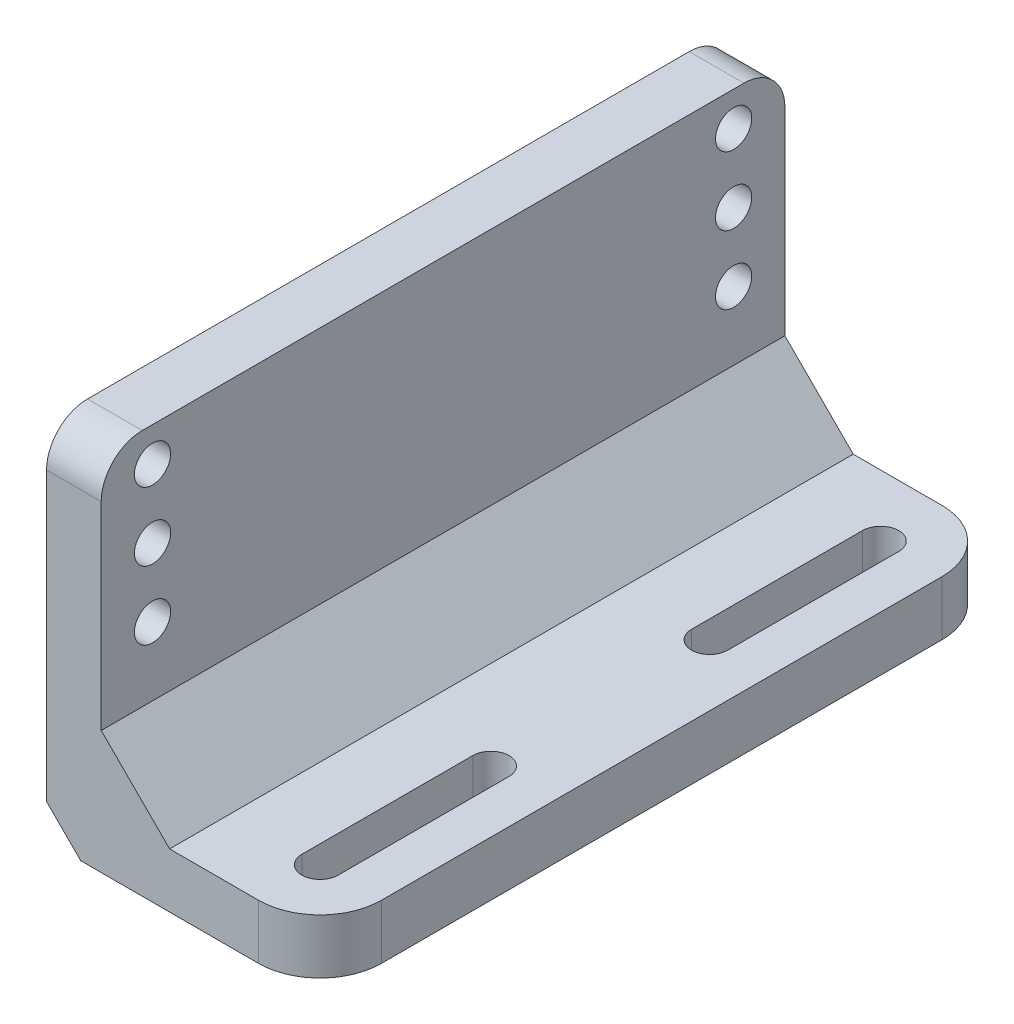
from build123d import *

# Parameters (mm, degrees)
SKETCH1_W           = 40
SKETCH1_H           = 100
BOSS_EXTRUDE1_DEPTH = 8
SKETCH2_W           = 100
SKETCH2_H           = 53
BOSS_EXTRUDE2_DEPTH = 8
SKETCH3_R           = 2.65
CUT_EXTRUDE1_DEPTH  = 118.613774703
FILLET1_R           = 6
CHAMFER2_SIZE       = 10
FILLET3_R           = 9
CUT_EXTRUDE3_DEPTH  = 117.726175299
CHAMFER1_SIZE       = 5


with BuildPart() as part:
    # Sketch1 → Boss-Extrude1 (new body)
    with BuildSketch(Plane(origin=(0, 0, 0), x_dir=(1, 0, 0), z_dir=(0, 1, 0))):
        with Locations((20, 50)):
            Rectangle(SKETCH1_W, SKETCH1_H)
    extrude(amount=BOSS_EXTRUDE1_DEPTH)

    # Sketch2 → Boss-Extrude2 (add)
    with BuildSketch(Plane.ZY):
        with Locations((-50, 26.5)):
            Rectangle(SKETCH2_W, SKETCH2_H)
    extrude(amount=-BOSS_EXTRUDE2_DEPTH)

    # Sketch3 → Cut-Extrude1 (cut, through all)
    with BuildSketch(Plane(origin=(8, 0, 0), x_dir=(0, 0, -1), z_dir=(1, 0, 0))):
        with Locations((7.5, 48)):
            Circle(SKETCH3_R)
        with Locations((92.5, 28)):
            Circle(SKETCH3_R)
        with Locations((92.5, 48)):
            Circle(SKETCH3_R)
        with Locations((92.5, 38)):
            Circle(SKETCH3_R)
        with Locations((7.5, 28)):
            Circle(SKETCH3_R)
        with Locations((7.5, 38)):
            Circle(SKETCH3_R)
    extrude(amount=-CUT_EXTRUDE1_DEPTH, mode=Mode.SUBTRACT)

    # Fillet1
    fillet1_edges = [part.edges().sort_by_distance(p)[0] for p in [
        (4, 53, -100),
        (4, 53, 0),
    ]]
    fillet(fillet1_edges, radius=FILLET1_R)

    # Chamfer2
    chamfer2_edges = [part.edges().sort_by_distance(p)[0] for p in [
        (8, 8, -50),
    ]]
    chamfer(chamfer2_edges, length=CHAMFER2_SIZE)

    # Fillet3
    fillet3_edges = [part.edges().sort_by_distance(p)[0] for p in [
        (40, 4, -100),
        (40, 4, 0),
    ]]
    fillet(fillet3_edges, radius=FILLET3_R)

    # Sketch5 → Cut-Extrude3 (cut, through all)
    with BuildSketch(Plane(origin=(0, 8, 0), x_dir=(1, 0, 0), z_dir=(0, 1, 0))):
        with BuildLine():
            Line((33.65, 91), (33.65, 66))
            ThreePointArc((33.65, 66), (31, 63.35), (28.35, 66))
            Line((28.35, 66), (28.35, 91))
            ThreePointArc((28.35, 91), (31, 93.65), (33.65, 91))
        make_face()
        with BuildLine():
            Line((33.65, 34), (33.65, 9))
            ThreePointArc((33.65, 9), (31, 6.35), (28.35, 9))
            Line((28.35, 9), (28.35, 34))
            ThreePointArc((28.35, 34), (31, 36.65), (33.65, 34))
        make_face()
    extrude(amount=-CUT_EXTRUDE3_DEPTH, mode=Mode.SUBTRACT)

    # Chamfer1
    chamfer1_edges = [part.edges().sort_by_distance(p)[0] for p in [
        (0, 0, -50),
    ]]
    chamfer(chamfer1_edges, length=CHAMFER1_SIZE)


solid = part.part
